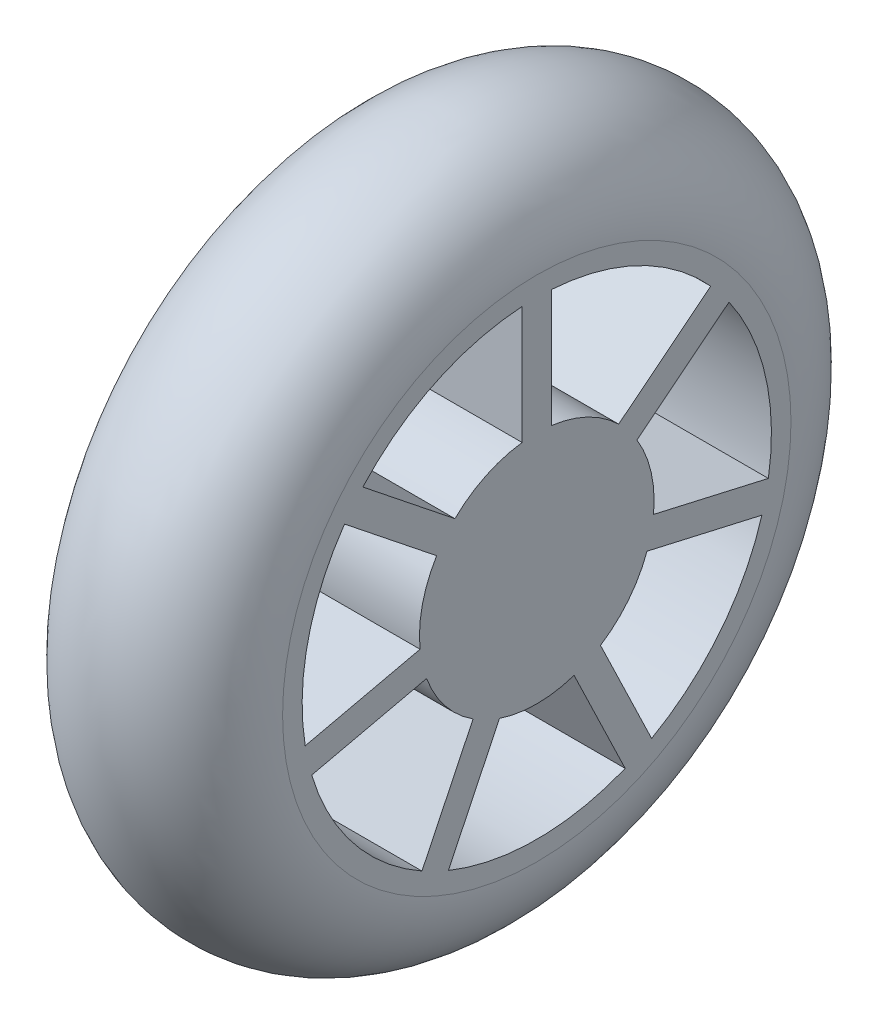
from build123d import *

# Parameters (mm, degrees)
CUT_EXTRUDE1_DEPTH = 55.699177456


with BuildPart() as part:
    # Sketch1 → Revolve1 (revolve)
    with BuildSketch(Plane.XY):
        with BuildLine():
            Line((0, 0), (20, 0))
            Line((20, 0), (20, 26))
            ThreePointArc((20, 26), (10, 36), (0, 26))
            Line((0, 26), (0, 0))
        make_face()
    revolve(axis=Axis((0, 0, 0), (1, 0, 0)))

    # Sketch2 → Cut-Extrude1 (cut, through all)
    with BuildSketch(Plane(origin=(20, 0, 0), x_dir=(0, 0, -1), z_dir=(1, 0, 0))):
        with BuildLine():
            ThreePointArc((-8.373157811, 8.595942547), (-5.206604869, 10.811626415), (-1.5, 11.9058809))
            Line((-1.5, 11.9058809), (-1.5, 23.953079134))
            ThreePointArc((-1.5, 23.953079134), (-10.413209739, 21.62325283), (-17.792036666, 16.107247787))
            Line((-17.792036666, 16.107247787), (-8.373157811, 8.595942547))
        make_face()
        with BuildLine():
            Line((1.5, 23.953079134), (1.5, 11.9058809))
            ThreePointArc((1.5, 11.9058809), (5.206604869, 10.811626415), (8.373157811, 8.595942547))
            Line((8.373157811, 8.595942547), (17.792036666, 16.107247787))
            ThreePointArc((17.792036666, 16.107247787), (10.413209739, 21.62325283), (1.5, 23.953079134))
        make_face()
        with BuildLine():
            ThreePointArc((-11.941157009, -1.186915869), (-11.699134946, 2.670251207), (-10.243627217, 6.250448099))
            Line((-10.243627217, 6.250448099), (-19.662506072, 13.761753339))
            ThreePointArc((-19.662506072, 13.761753339), (-23.398269892, 5.340502415), (-23.686306831, -3.867669672))
            Line((-23.686306831, -3.867669672), (-11.941157009, -1.186915869))
        make_face()
        with BuildLine():
            Line((19.662506072, 13.761753339), (10.243627217, 6.250448099))
            ThreePointArc((10.243627217, 6.250448099), (11.699134946, 2.670251207), (11.941157009, -1.186915869))
            Line((11.941157009, -1.186915869), (23.686306831, -3.867669672))
            ThreePointArc((23.686306831, -3.867669672), (23.398269892, 5.340502415), (19.662506072, 13.761753339))
        make_face()
        with BuildLine():
            ThreePointArc((-6.517221424, -10.076002427), (-9.38197779, -7.481877622), (-11.273594207, -4.111699606))
            Line((-11.273594207, -4.111699606), (-23.01874403, -6.792453408))
            ThreePointArc((-23.01874403, -6.792453408), (-18.763955579, -14.963755245), (-11.74430484, -20.930152981))
            Line((-11.74430484, -20.930152981), (-6.517221424, -10.076002427))
        make_face()
        with BuildLine():
            Line((23.01874403, -6.792453408), (11.273594207, -4.111699606))
            ThreePointArc((11.273594207, -4.111699606), (9.38197779, -7.481877622), (6.517221424, -10.076002427))
            Line((6.517221424, -10.076002427), (11.74430484, -20.930152981))
            ThreePointArc((11.74430484, -20.930152981), (18.763955579, -14.963755245), (23.01874403, -6.792453408))
        make_face()
        with BuildLine():
            ThreePointArc((3.81431482, -11.377653644), (0, -12), (-3.81431482, -11.377653644))
            Line((-3.81431482, -11.377653644), (-9.041398236, -22.231804199))
            ThreePointArc((-9.041398236, -22.231804199), (0, -24), (9.041398236, -22.231804199))
            Line((9.041398236, -22.231804199), (3.81431482, -11.377653644))
        make_face()
    extrude(amount=-CUT_EXTRUDE1_DEPTH, mode=Mode.SUBTRACT)


solid = part.part
